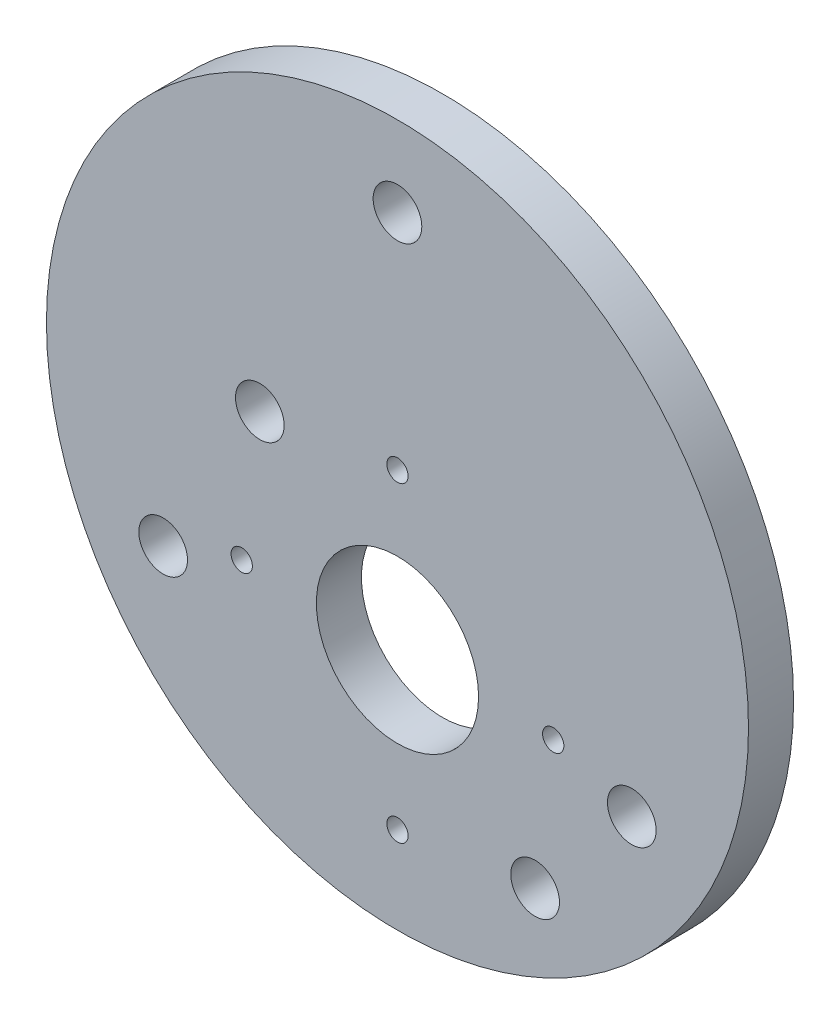
from build123d import *

# Parameters (mm, degrees)
SKETCH1_R                        = 49.4665
BOSS_EXTRUDE1_DEPTH              = 6.35
M3_SCREW_HOLE_3_0MM_DOWEL_HOLE_D = 3
SKETCH5_R                        = 3.429
CUT_EXTRUDE1_DEPTH               = 71.243802179
SKETCH6_R                        = 3.429
CUT_EXTRUDE2_DEPTH               = 71.243802179
SKETCH7_R                        = 11.43
CUT_EXTRUDE3_DEPTH               = 71.243802179


with BuildPart() as part:
    # Sketch1 → Boss-Extrude1 (new body)
    with BuildSketch(Plane.XY):
        Circle(SKETCH1_R)
    extrude(amount=BOSS_EXTRUDE1_DEPTH)

    # M3 Screw Hole - Ø3.0mm Dowel Hole (through all)
    with Locations(Plane.XY.offset(6.35)):
        with Locations((0, 6.70774596), (-21.94774596, -15.24), (0, -37.18774596), (21.94774596, -15.24)):
            Hole(M3_SCREW_HOLE_3_0MM_DOWEL_HOLE_D / 2)

    # Sketch5 → Cut-Extrude1 (cut, through all)
    with BuildSketch(Plane.XY.offset(6.35)):
        with Locations((19.397353222, -34.637353222)):
            Circle(SKETCH5_R)
        with Locations((-19.397353222, 4.157353222)):
            Circle(SKETCH5_R)
    extrude(amount=-CUT_EXTRUDE1_DEPTH, mode=Mode.SUBTRACT)

    # Sketch6 → Cut-Extrude2 (cut, through all)
    with BuildSketch(Plane.XY.offset(6.35)):
        with Locations((0, 38.128211777)):
            Circle(SKETCH6_R)
        with Locations((-33.02, -19.064105889)):
            Circle(SKETCH6_R)
        with Locations((33.02, -19.064105889)):
            Circle(SKETCH6_R)
    extrude(amount=-CUT_EXTRUDE2_DEPTH, mode=Mode.SUBTRACT)

    # Sketch7 → Cut-Extrude3 (cut, through all)
    with BuildSketch(Plane.XY.offset(6.35)):
        with Locations((0, -15.24)):
            Circle(SKETCH7_R)
    extrude(amount=-CUT_EXTRUDE3_DEPTH, mode=Mode.SUBTRACT)


solid = part.part
